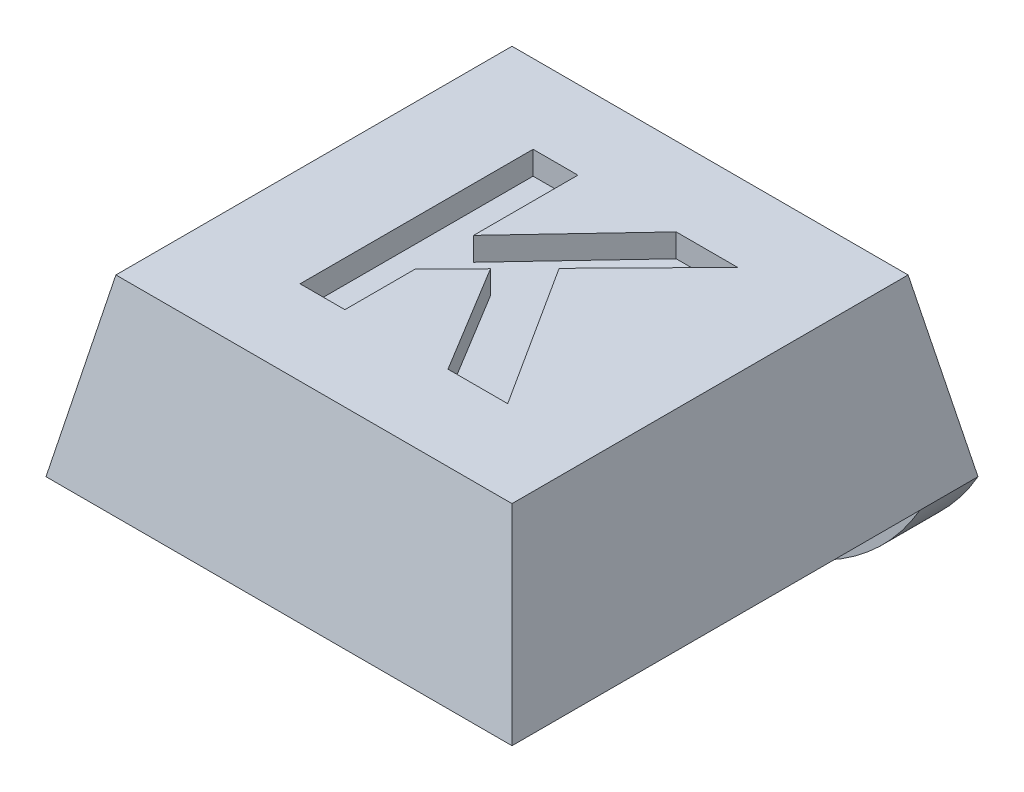
from build123d import *

# Parameters (mm, degrees)
SKETCH1_W               = 8
SKETCH1_H               = 8
BOSS_EXTRUDE1_DEPTH     = 3
CUT_EXTRUDE1_DEPTH      = 12.704699911
CUT_EXTRUDE1_DEPTH_BACK = 12.704699911
CUT_EXTRUDE2_DEPTH      = 11
SKETCH4_R               = 1.75
CUT_EXTRUDE3_DEPTH      = 0.4
SKETCH5_W               = 8
SKETCH5_H               = 1
BOSS_EXTRUDE2_DEPTH     = 2
FILLET1_R               = 4
CUT_EXTRUDE4_DEPTH      = 0.4


with BuildPart() as part:
    # Sketch1 → Boss-Extrude1 (new body)
    with BuildSketch(Plane(origin=(0, 0, 0), x_dir=(1, 0, 0), z_dir=(0, 1, 0))):
        with Locations((4, 4)):
            Rectangle(SKETCH1_W, SKETCH1_H)
    extrude(amount=BOSS_EXTRUDE1_DEPTH)

    # Sketch2 → Cut-Extrude1 (cut, two sides: drawn at the far end of the back side and taken through both)
    with BuildSketch(Plane.XY.offset(-CUT_EXTRUDE1_DEPTH_BACK)):
        Polygon((0, 0), (0.6, 3), (0, 3), align=None)
        Polygon((8, 0), (7.4, 3), (8, 3), align=None)
    extrude(amount=CUT_EXTRUDE1_DEPTH + CUT_EXTRUDE1_DEPTH_BACK, mode=Mode.SUBTRACT)

    # Sketch3 → Cut-Extrude2 (cut)
    with BuildSketch(Plane(origin=(0, 0, 0), x_dir=(0, 0, -1), z_dir=(1, 0, 0))):
        Polygon((0, 0), (0.6, 3), (0, 3), align=None)
        Polygon((8, 3), (7.4, 3), (8, 0), align=None)
    extrude(amount=CUT_EXTRUDE2_DEPTH, mode=Mode.SUBTRACT)

    # Sketch4 → Cut-Extrude3 (cut)
    with BuildSketch(Plane.XZ):
        with Locations(Location((4, -3.75, 0), (0, 0, 270))):
            Circle(SKETCH4_R)
    extrude(amount=-CUT_EXTRUDE3_DEPTH, mode=Mode.SUBTRACT)

    # Sketch5 → Boss-Extrude2 (add)
    with BuildSketch(Plane.XZ):
        with Locations((4, -7.5)):
            Rectangle(SKETCH5_W, SKETCH5_H)
    extrude(amount=BOSS_EXTRUDE2_DEPTH)

    # Fillet1
    # the kernel refuses this fillet: 4 mm, written as the material it takes off along each edge
    with BuildSketch(Plane(origin=(8, -2, -16.660254038), x_dir=(0, 1, 0), z_dir=(0, 0, 1)), Plane(origin=(0, -2, 1.660254038), x_dir=(0, 1, 0), z_dir=(0, 0, -1))) as fillet1_piece_1:
        with BuildLine():
            CenterArc((4, 3.464101615), FILLET1_R, 180, 60)
            Line((0, 3.464101615), (-0.08, 3.464101615))
            Line((-0.08, 3.464101615), (-0.08, 0))
            Line((-0.08, 0), (0, -0.08))
            ThreePointArc((0, -0.08), (1, -0.08), (1.96, -0.069282032))
            Line((1.96, -0.069282032), (2, 0))
        make_face()
    extrude(amount=18.320508076, mode=Mode.SUBTRACT)

    # Sketch6 → Cut-Extrude4 (cut)
    with BuildSketch(Plane(origin=(0, 3, 0), x_dir=(1, 0, 0), z_dir=(0, 1, 0))):
        Polygon((2.312898911, 2.049121591), (2.312898911, 6.049121591), (3.08212968, 6.049121591), (3.08212968, 4.258256206), (4.768828398, 6.049121591), (5.825719424, 6.049121591), (4.306488654, 4.502647232), (5.877001475, 2.049121591), (4.852161731, 2.049121591), (3.723155321, 3.907294667), (3.08212968, 3.255051078), (3.08212968, 2.049121591), align=None)
    extrude(amount=-CUT_EXTRUDE4_DEPTH, mode=Mode.SUBTRACT)


solid = part.part
